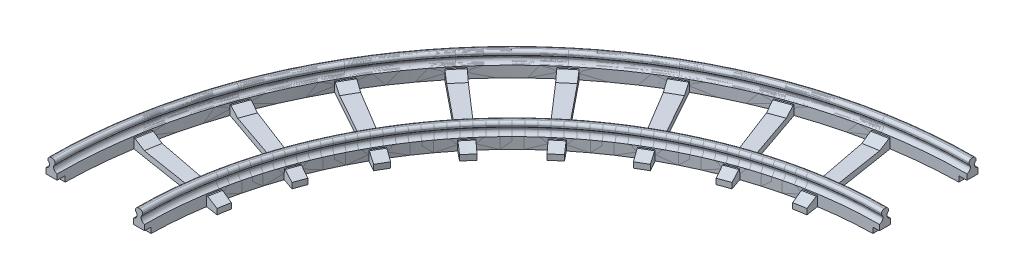
from build123d import *

# Parameters (mm, degrees)
REVOLVE_1_ANGLE          = 10
FILLET_1_R               = 1.5
FILLET_2_R               = 1.5
FILLET_3_R               = 1
FILLET_4_R               = 1
SKETCH_7_W               = 4
SKETCH_7_H               = 2
CUT_REVOLVE_1_ANGLE      = 1
SKETCH_10_R              = 0.4
CUT_EXTRUDE_1_DEPTH      = 2
REVOLVE_2_ANGLE          = 1
PATTERN_CIRCULAR_1_COUNT = 8
PATTERN_CIRCULAR_1_ANGLE = 70


with BuildPart() as part:
    # 草图4 → 旋转1 (revolve)
    with BuildSketch(Plane.XY):
        Polygon((0.75, -1.5), (1.25, -1.5), (1.25, 0), (0, 0), (-1.25, 0), (-1.25, -1.5), (-0.75, -1.5), (-0.75, -4), (-2, -4), (-2, -8), (0, -8), (2, -8), (2, -4), (0.75, -4), align=None)
        Polygon((31.5, 0), (32.75, 0), (32.75, -1.5), (32.25, -1.5), (32.25, -4), (33.5, -4), (33.5, -8), (31.5, -8), (29.5, -8), (29.5, -4), (30.75, -4), (30.75, -1.5), (30.25, -1.5), (30.25, 0), align=None)
    revolve(axis=Axis((165.75, 3.853460973, 0), (0, -1, 0)), revolution_arc=REVOLVE_1_ANGLE)

    # 圆角1
    # the kernel refuses this fillet: 1.5 mm, written as the material it adds along each edge
    with BuildSketch(Plane(origin=(165.75, -4, 0), x_dir=(-1, 0, 0), z_dir=(0, 0, 1))) as fillet_1_piece_1:
        with BuildLine():
            CenterArc((163.5, -1.479019946), FILLET_1_R, 0, 80.405931773)
            Line((165, -1.479019946), (165.03, -1.479019946))
            Line((165.03, -1.479019946), (165.03, 0))
            Line((165.03, 0), (165, 0.03))
            ThreePointArc((165, 0.03), (164.375, 0.03), (163.755, 0.029580399))
            Line((163.755, 0.029580399), (163.75, 0))
        make_face()
    revolve(axis=Axis((165.75, -4, 0), (0, -1, 0)), revolution_arc=10)
    with BuildSketch(Plane(origin=(165.75, -4, 0), x_dir=(-1, 0, 0), z_dir=(0, 0, 1))) as fillet_1_piece_2:
        with BuildLine():
            CenterArc((168, -1.479019946), FILLET_1_R, 99.594068227, 80.405931773)
            Line((166.5, -1.479019946), (166.47, -1.479019946))
            Line((166.47, -1.479019946), (166.47, 0))
            Line((166.47, 0), (166.5, 0.03))
            ThreePointArc((166.5, 0.03), (167.125, 0.03), (167.745, 0.029580399))
            Line((167.745, 0.029580399), (167.75, 0))
        make_face()
    revolve(axis=Axis((165.75, -4, 0), (0, -1, 0)), revolution_arc=10)

    # 圆角2
    # the kernel refuses this fillet: 1.5 mm, written as the material it adds along each edge
    with BuildSketch(Plane(origin=(165.75, -4, 0), x_dir=(-1, 0, 0), z_dir=(0, 0, 1))) as fillet_2_piece_1:
        with BuildLine():
            CenterArc((136.5, -1.479019946), FILLET_2_R, 99.594068227, 80.405931773)
            Line((136.25, 0), (136.245, 0.029580399))
            ThreePointArc((136.245, 0.029580399), (135.625, 0.03), (135, 0.03))
            Line((135, 0.03), (134.97, 0))
            Line((134.97, 0), (134.97, -1.479019946))
            Line((134.97, -1.479019946), (135, -1.479019946))
        make_face()
    revolve(axis=Axis((165.75, -4, 0), (0, -1, 0)), revolution_arc=10)
    with BuildSketch(Plane(origin=(165.75, -4, 0), x_dir=(-1, 0, 0), z_dir=(0, 0, 1))) as fillet_2_piece_2:
        with BuildLine():
            CenterArc((132, -1.479019946), FILLET_2_R, 0, 80.405931773)
            Line((133.5, -1.479019946), (133.53, -1.479019946))
            Line((133.53, -1.479019946), (133.53, 0))
            Line((133.53, 0), (133.5, 0.03))
            ThreePointArc((133.5, 0.03), (132.875, 0.03), (132.255, 0.029580399))
            Line((132.255, 0.029580399), (132.25, 0))
        make_face()
    revolve(axis=Axis((165.75, -4, 0), (0, -1, 0)), revolution_arc=10)

    # 圆角3
    # the kernel refuses this fillet: 1 mm, written as the material it adds along each edge
    with BuildSketch(Plane(origin=(165.75, -1.5, 0), x_dir=(-1, 0, 0), z_dir=(0, 0, 1))) as fillet_3_piece_1:
        with BuildLine():
            CenterArc((136, 0.866025404), FILLET_3_R, 180, 60)
            Line((135, 0.866025404), (135, 0))
            Line((135, 0), (135.5, 0))
        make_face()
    revolve(axis=Axis((165.75, -1.5, 0), (0, -1, 0)), revolution_arc=10)
    with BuildSketch(Plane(origin=(165.75, -1.5, 0), x_dir=(-1, 0, 0), z_dir=(0, 0, 1))) as fillet_3_piece_2:
        with BuildLine():
            CenterArc((132.5, 0.866025404), FILLET_3_R, 300, 60)
            Line((133, 0), (133.5, 0))
            Line((133.5, 0), (133.5, 0.866025404))
        make_face()
    revolve(axis=Axis((165.75, -1.5, 0), (0, -1, 0)), revolution_arc=10)
    # the kernel refuses this fillet: 1 mm, written as the material it takes off along each edge
    with BuildSketch(Plane(origin=(165.75, 0, 0), x_dir=(-0.9998233399867428, 0, 0.018795978765534377), z_dir=(0.018795978765534377, 0, 0.9998233399867428))) as fillet_3_2_piece_1:
        with BuildLine():
            CenterArc((133 + FILLET_3_R, FILLET_3_R), FILLET_3_R, 180, 90)
            Line((133, FILLET_3_R), (133, 0))
            Line((133, 0), (133 + FILLET_3_R, 0))
        make_face()
    revolve(axis=Axis((165.75, 0, 0), (0, -1, 0)), revolution_arc=12.153987353, mode=Mode.SUBTRACT)
    with BuildSketch(Plane(origin=(165.75, 0, 0), x_dir=(-0.9998297984864879, 0, 0.01844922921070363), z_dir=(0.01844922921070363, 0, 0.9998297984864879))) as fillet_3_2_piece_2:
        with BuildLine():
            CenterArc((135.5 - FILLET_3_R, FILLET_3_R), FILLET_3_R, 270, 90)
            Line((135.5 - FILLET_3_R, 0), (135.5, 0))
            Line((135.5, 0), (135.5, FILLET_3_R))
        make_face()
    revolve(axis=Axis((165.75, 0, 0), (0, -1, 0)), revolution_arc=12.114245889, mode=Mode.SUBTRACT)

    # 圆角4
    # the kernel refuses this fillet: 1 mm, written as the material it adds along each edge
    with BuildSketch(Plane(origin=(165.75, -1.5, 0), x_dir=(-1, 0, 0), z_dir=(0, 0, 1))) as fillet_4_piece_1:
        with BuildLine():
            CenterArc((167.5, 0.866025404), FILLET_4_R, 180, 60)
            Line((167, 0), (166.5, 0))
            Line((166.5, 0), (166.5, 0.866025404))
        make_face()
    revolve(axis=Axis((165.75, -1.5, 0), (0, -1, 0)), revolution_arc=10)
    with BuildSketch(Plane(origin=(165.75, -1.5, 0), x_dir=(-1, 0, 0), z_dir=(0, 0, 1))) as fillet_4_piece_2:
        with BuildLine():
            CenterArc((164, 0.866025404), FILLET_4_R, 300, 60)
            Line((164.5, 0), (165, 0))
            Line((165, 0), (165, 0.866025404))
        make_face()
    revolve(axis=Axis((165.75, -1.5, 0), (0, -1, 0)), revolution_arc=10)
    # the kernel refuses this fillet: 1 mm, written as the material it takes off along each edge
    with BuildSketch(Plane(origin=(165.75, 0, 0), x_dir=(-0.9998845180351503, 0, 0.015197058715919934), z_dir=(0.015197058715919934, 0, 0.9998845180351503))) as fillet_4_2_piece_1:
        with BuildLine():
            CenterArc((164.5 + FILLET_4_R, FILLET_4_R), FILLET_4_R, 180, 90)
            Line((164.5, FILLET_4_R), (164.5, 0))
            Line((164.5, 0), (164.5 + FILLET_4_R, 0))
        make_face()
    revolve(axis=Axis((165.75, 0, 0), (0, -1, 0)), revolution_arc=11.74152169, mode=Mode.SUBTRACT)
    with BuildSketch(Plane(origin=(165.75, 0, 0), x_dir=(-0.9998879496351009, 0, 0.014969574961036002), z_dir=(0.014969574961036002, 0, 0.9998879496351009))) as fillet_4_2_piece_2:
        with BuildLine():
            CenterArc((167 - FILLET_4_R, FILLET_4_R), FILLET_4_R, 270, 90)
            Line((167 - FILLET_4_R, 0), (167, 0))
            Line((167, 0), (167, FILLET_4_R))
        make_face()
    revolve(axis=Axis((165.75, 0, 0), (0, -1, 0)), revolution_arc=11.715451006, mode=Mode.SUBTRACT)

    # 草图7 → 切除-旋转1 (revolve, cut)
    with BuildSketch(Plane.XY):
        with Locations((0, -7)):
            Rectangle(SKETCH_7_W, SKETCH_7_H)
        with Locations((31.5, -7)):
            Rectangle(SKETCH_7_W, SKETCH_7_H)
    revolve(axis=Axis((165.75, 3.853460973, 0), (0, -1, 0)), revolution_arc=CUT_REVOLVE_1_ANGLE, mode=Mode.SUBTRACT)

    # 草图10 → 切除-拉伸1 (cut)
    with BuildSketch(Plane.XZ.offset(6)):
        with Locations(Location((0.006311252, -1.446423259, 0), (0, 0, 270))):
            Circle(SKETCH_10_R)
        with Locations(Location((31.505111829, -1.171537391, 0), (0, 0, 270))):
            Circle(SKETCH_10_R)
    extrude(amount=-CUT_EXTRUDE_1_DEPTH, mode=Mode.SUBTRACT)

    # 草图11 → 旋转2 (revolve)
    with BuildSketch(Plane(origin=(4.997974052, 0, -28.344919378), x_dir=(-0.9848077530122081, 0, -0.17364817766693072), z_dir=(0.17364817766693072, 0, -0.9848077530122081))):
        Polygon((-26.981885062, -4.5), (-26.481885062, -4.5), (-22.481885062, -6), (-3.981885062, -6), (0.018114938, -4.5), (0.518114938, -4.5), (4.518114938, -4.5), (5.018114938, -4.5), (9.018114938, -6), (9.018114938, -8), (4.518114938, -8), (0.518114938, -8), (-26.981885062, -8), (-30.981885062, -8), (-35.481885062, -8), (-35.481885062, -6), (-31.481885062, -4.5), (-30.981885062, -4.5), align=None)
    revolve(axis=Axis((165.75, 3.853460973, 0), (0, 1, 0)), revolution_arc=REVOLVE_2_ANGLE)

    # 镜向1: part across face


with BuildPart() as part_1:
    add(part.part)
    add(part.part.mirror(Plane(origin=(18.028837048, -5.996688627, -26.04722665), x_dir=(0.9848077529548817, 0, 0.17364817799204443), z_dir=(0.17364817799204443, 0, -0.9848077529548818))))


with BuildPart() as pattern_circular_1_1:
    # 阵列(圆周)1: pattern copy
    add(part_1.part.rotate(Axis((165.75, 0, 0), (0, -1, 0)), 1 * PATTERN_CIRCULAR_1_ANGLE / (PATTERN_CIRCULAR_1_COUNT - 1)))


with BuildPart() as pattern_circular_1_2:
    # 阵列(圆周)1: pattern copy
    add(part_1.part.rotate(Axis((165.75, 0, 0), (0, -1, 0)), 2 * PATTERN_CIRCULAR_1_ANGLE / (PATTERN_CIRCULAR_1_COUNT - 1)))


with BuildPart() as pattern_circular_1_3:
    # 阵列(圆周)1: pattern copy
    add(part_1.part.rotate(Axis((165.75, 0, 0), (0, -1, 0)), 3 * PATTERN_CIRCULAR_1_ANGLE / (PATTERN_CIRCULAR_1_COUNT - 1)))


with BuildPart() as pattern_circular_1_4:
    # 阵列(圆周)1: pattern copy
    add(part_1.part.rotate(Axis((165.75, 0, 0), (0, -1, 0)), 4 * PATTERN_CIRCULAR_1_ANGLE / (PATTERN_CIRCULAR_1_COUNT - 1)))


with BuildPart() as pattern_circular_1_5:
    # 阵列(圆周)1: pattern copy
    add(part_1.part.rotate(Axis((165.75, 0, 0), (0, -1, 0)), 5 * PATTERN_CIRCULAR_1_ANGLE / (PATTERN_CIRCULAR_1_COUNT - 1)))


with BuildPart() as pattern_circular_1_6:
    # 阵列(圆周)1: pattern copy
    add(part_1.part.rotate(Axis((165.75, 0, 0), (0, -1, 0)), 6 * PATTERN_CIRCULAR_1_ANGLE / (PATTERN_CIRCULAR_1_COUNT - 1)))


with BuildPart() as pattern_circular_1_7:
    # 阵列(圆周)1: pattern copy
    add(part_1.part.rotate(Axis((165.75, 0, 0), (0, -1, 0)), 7 * PATTERN_CIRCULAR_1_ANGLE / (PATTERN_CIRCULAR_1_COUNT - 1)))


solid = Compound([part_1.part, pattern_circular_1_1.part, pattern_circular_1_2.part, pattern_circular_1_3.part, pattern_circular_1_4.part, pattern_circular_1_5.part, pattern_circular_1_6.part, pattern_circular_1_7.part])
